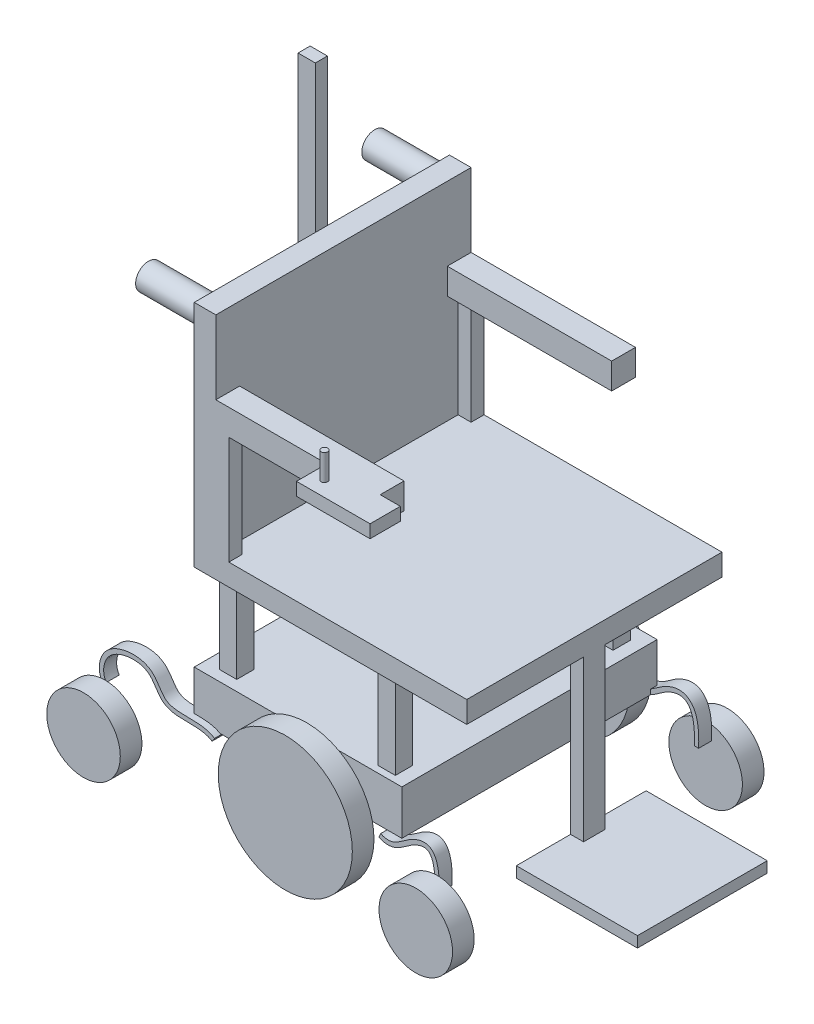
from build123d import *

# Parameters (mm, degrees)
SKETCH3_R            = 155
BOSS_EXTRUDE1_DEPTH  = 50
SKETCH9_R            = 33.926511192
BOSS_EXTRUDE3_DEPTH  = 590
BOSS_EXTRUDE4_START  = 50
SKETCH11_R           = 155
BOSS_EXTRUDE4_DEPTH  = 50
SKETCH12_W           = 480
SKETCH12_H           = 102.963387116
BOSS_EXTRUDE5_DEPTH  = 590
SKETCH15_W           = 40
SKETCH15_H           = 40
BOSS_EXTRUDE6_DEPTH  = 200
SKETCH16_W           = 40
SKETCH16_H           = 40
BOSS_EXTRUDE7_DEPTH  = 200
SKETCH17_W           = 40
SKETCH17_H           = 40
BOSS_EXTRUDE8_DEPTH  = 200
SKETCH18_W           = 40
SKETCH18_H           = 40
BOSS_EXTRUDE9_DEPTH  = 200
SKETCH20_W           = 480
SKETCH20_H           = 590
BOSS_EXTRUDE10_DEPTH = 50
SKETCH21_W           = 50
SKETCH21_H           = 590
BOSS_EXTRUDE11_DEPTH = 480
SKETCH23_R           = 30
BOSS_EXTRUDE12_DEPTH = 140
SKETCH24_R           = 30
BOSS_EXTRUDE13_DEPTH = 140
SKETCH40_W           = 30
SKETCH40_H           = 30
BOSS_EXTRUDE25_DEPTH = 250
SKETCH42_W           = 30
SKETCH42_H           = 30
BOSS_EXTRUDE26_DEPTH = 250
SKETCH45_W           = 380
SKETCH45_H           = 55
BOSS_EXTRUDE27_DEPTH = 60
SKETCH46_W           = 380
SKETCH46_H           = 55
BOSS_EXTRUDE28_DEPTH = 60
SKETCH48_W           = 590
SKETCH48_H           = 50
BOSS_EXTRUDE29_DEPTH = 150
SKETCH55_W           = 30
SKETCH55_H           = 50
BOSS_EXTRUDE31_DEPTH = 370
SKETCH58_W           = 280
SKETCH58_H           = 300
BOSS_EXTRUDE32_DEPTH = 25
EXTRUDE_THIN2_START  = -15
EXTRUDE_THIN2_DEPTH  = 30
SKETCH62_R           = 85
BOSS_EXTRUDE33_DEPTH = 50
EXTRUDE_THIN3_START  = -15
EXTRUDE_THIN3_DEPTH  = 30
SKETCH64_R           = 85
BOSS_EXTRUDE34_DEPTH = 50
EXTRUDE_THIN5_START  = -15
EXTRUDE_THIN5_DEPTH  = 30
EXTRUDE_THIN7_START  = -15
EXTRUDE_THIN7_DEPTH  = 30
SKETCH73_R           = 85
BOSS_EXTRUDE37_DEPTH = 50
SKETCH74_R           = 85
BOSS_EXTRUDE38_DEPTH = 50
SKETCH75_W           = 170
SKETCH75_H           = 30
BOSS_EXTRUDE39_DEPTH = 70
SKETCH76_R           = 7.5
BOSS_EXTRUDE40_DEPTH = 60
SKETCH77_W           = 27.937530969
SKETCH77_H           = 850
BOSS_EXTRUDE41_DEPTH = 40


# Read off the part's stored shape, not the designer's step: Extrude-Thin2, Extrude-Thin3, Extrude-Thin5, Extrude-Thin7
with BuildPart() as part:
    # Sketch3 → Boss-Extrude1 (new body)
    with BuildSketch(Plane.XY):
        with Locations((59.083093739, -136.412437016)):
            Circle(SKETCH3_R)
    extrude(amount=BOSS_EXTRUDE1_DEPTH)

    # Sketch9 → Boss-Extrude3 (add)
    with BuildSketch(Plane(origin=(0, 0, 0), x_dir=(-1, 0, 0), z_dir=(0, 0, -1))):
        with Locations((-59.083093739, -136.412437016)):
            Circle(SKETCH9_R)
    extrude(amount=BOSS_EXTRUDE3_DEPTH)

    # Sketch11 → Boss-Extrude4 (add)
    with BuildSketch(Plane(origin=(0, 0, -590), x_dir=(-1, 0, 0), z_dir=(0, 0, -1)).offset(BOSS_EXTRUDE4_START)):
        with Locations(Location((-59.083093739, -136.412437016, 0), (0, 0, 180))):
            Circle(SKETCH11_R)
    extrude(amount=-BOSS_EXTRUDE4_DEPTH)

    # Sketch12 → Boss-Extrude5 (add)
    with BuildSketch(Plane.XY.offset(-590)):
        with Locations((38.586487045, -51.481693558)):
            Rectangle(SKETCH12_W, SKETCH12_H)
    extrude(amount=BOSS_EXTRUDE5_DEPTH)

    # Sketch15 → Boss-Extrude6 (add)
    with BuildSketch(Plane(origin=(0, 0, 0), x_dir=(1, 0, 0), z_dir=(0, 1, 0))):
        with Locations((-143.865194173, 535.654594347)):
            Rectangle(SKETCH15_W, SKETCH15_H)
    extrude(amount=BOSS_EXTRUDE6_DEPTH)

    # Sketch16 → Boss-Extrude7 (add)
    with BuildSketch(Plane(origin=(0, 0, 0), x_dir=(1, 0, 0), z_dir=(0, 1, 0))):
        with Locations((229.11629966, 537.488381873)):
            Rectangle(SKETCH16_W, SKETCH16_H)
    extrude(amount=BOSS_EXTRUDE7_DEPTH)

    # Sketch17 → Boss-Extrude8 (add)
    with BuildSketch(Plane(origin=(0, 0, 0), x_dir=(1, 0, 0), z_dir=(0, 1, 0))):
        with Locations((-147.428064277, 44.245166341)):
            Rectangle(SKETCH17_W, SKETCH17_H)
    extrude(amount=BOSS_EXTRUDE8_DEPTH)

    # Sketch18 → Boss-Extrude9 (add)
    with BuildSketch(Plane(origin=(0, 0, 0), x_dir=(1, 0, 0), z_dir=(0, 1, 0))):
        with Locations((228.056842418, 35.446711217)):
            Rectangle(SKETCH18_W, SKETCH18_H)
    extrude(amount=BOSS_EXTRUDE9_DEPTH)

    # Sketch20 → Boss-Extrude10 (add)
    with BuildSketch(Plane(origin=(0, 200, 0), x_dir=(1, 0, 0), z_dir=(0, 1, 0))):
        with Locations((38.586487045, 295)):
            Rectangle(SKETCH20_W, SKETCH20_H)
    extrude(amount=BOSS_EXTRUDE10_DEPTH)

    # Sketch21 → Boss-Extrude11 (add)
    with BuildSketch(Plane(origin=(0, 250, 0), x_dir=(1, 0, 0), z_dir=(0, 1, 0))):
        with Locations((-176.413512955, 295)):
            Rectangle(SKETCH21_W, SKETCH21_H)
    extrude(amount=BOSS_EXTRUDE11_DEPTH)

    # Sketch23 → Boss-Extrude12 (add)
    with BuildSketch(Plane.ZY.offset(201.413512955)):
        with Locations(Location((-557.303178405, 697.091827005, 0), (0, 0, 180))):
            Circle(SKETCH23_R)
    extrude(amount=BOSS_EXTRUDE12_DEPTH)

    # Sketch24 → Boss-Extrude13 (add)
    with BuildSketch(Plane.ZY.offset(201.413512955)):
        with Locations(Location((-34.49114625, 695.325475635, 0), (0, 0, 180))):
            Circle(SKETCH24_R)
    extrude(amount=BOSS_EXTRUDE13_DEPTH)

    # Sketch40 → Boss-Extrude25 (add)
    with BuildSketch(Plane(origin=(0, 250, 0), x_dir=(1, 0, 0), z_dir=(0, 1, 0))):
        with Locations((-136.413512955, 15)):
            Rectangle(SKETCH40_W, SKETCH40_H)
    extrude(amount=BOSS_EXTRUDE25_DEPTH)

    # Sketch42 → Boss-Extrude26 (add)
    with BuildSketch(Plane(origin=(0, 250, 0), x_dir=(1, 0, 0), z_dir=(0, 1, 0))):
        with Locations((-136.413512955, 575)):
            Rectangle(SKETCH42_W, SKETCH42_H)
    extrude(amount=BOSS_EXTRUDE26_DEPTH)

    # Sketch45 → Boss-Extrude27 (add)
    with BuildSketch(Plane(origin=(0, 500, 0), x_dir=(1, 0, 0), z_dir=(0, 1, 0))):
        with Locations((38.586487045, 562.5)):
            Rectangle(SKETCH45_W, SKETCH45_H)
    extrude(amount=BOSS_EXTRUDE27_DEPTH)

    # Sketch46 → Boss-Extrude28 (add)
    with BuildSketch(Plane(origin=(0, 500, 0), x_dir=(1, 0, 0), z_dir=(0, 1, 0))):
        with Locations((38.586487045, 27.5)):
            Rectangle(SKETCH46_W, SKETCH46_H)
    extrude(amount=BOSS_EXTRUDE28_DEPTH)

    # Sketch48 → Boss-Extrude29 (add)
    with BuildSketch(Plane(origin=(278.586487045, 0, 0), x_dir=(0, 0, -1), z_dir=(1, 0, 0))):
        with Locations((295, 225)):
            Rectangle(SKETCH48_W, SKETCH48_H)
    extrude(amount=BOSS_EXTRUDE29_DEPTH)

    # Sketch55 → Boss-Extrude31 (add)
    with BuildSketch(Plane.XZ.offset(-200)):
        with Locations((413.586487045, -295)):
            Rectangle(SKETCH55_W, SKETCH55_H)
    extrude(amount=BOSS_EXTRUDE31_DEPTH)

    # Sketch58 → Boss-Extrude32 (add)
    with BuildSketch(Plane.XZ.offset(170)):
        with Locations((538.586487045, -294.597349054)):
            Rectangle(SKETCH58_W, SKETCH58_H)
    extrude(amount=BOSS_EXTRUDE32_DEPTH)

    # Extrude-Thin3 outline → Extrude-Thin3 (add)
    with BuildSketch(Plane.XY.offset(EXTRUDE_THIN3_START)):
        with BuildLine():
            Line((-145.070222728, -112.805694413), (-139.490171597, -104.507319309))
            add(Edge.make_bspline(
                [(-139.490171597, -104.507319309), (-141.07934136, -103.438718719), (-142.717912679, -102.475309527), (-146.066329191, -100.739710195), (-147.776160212, -99.967366778), (-152.982207486, -97.900745756), (-156.552965302, -96.855815655), (-163.8031578, -95.237844926), (-167.484455282, -94.664452977), (-174.907126528, -93.826813973), (-178.649185641, -93.562985527), (-186.144159647, -93.210750081), (-189.897218094, -93.122646574), (-197.354363274, -93.004015562), (-201.058455456, -92.97359066), (-208.346227164, -92.862142088), (-211.929878075, -92.781047653), (-218.894280326, -92.469359528), (-222.27488758, -92.238520889), (-228.741754545, -91.542444776), (-231.827437792, -91.076872695), (-237.613321297, -89.849742562), (-240.312032095, -89.088431948), (-245.262529472, -87.236577748), (-247.512831042, -86.148517588), (-250.568062019, -84.2399557), (-251.533967191, -83.55735024), (-252.912198127, -82.452991131), (-253.357343745, -82.073390914), (-254.253991896, -81.261386696), (-254.702424067, -80.83169464), (-256.048576921, -79.473156861), (-256.947051188, -78.474459999), (-258.747728739, -76.311448698), (-259.649790135, -75.147371638), (-262.370359099, -71.452133495), (-264.199970001, -68.718206192), (-268.018569401, -62.97989462), (-270.007806703, -59.975635165), (-273.280437529, -55.468611007), (-274.420207205, -53.966098787), (-276.834443872, -50.997417761), (-278.109020871, -49.531063348), (-280.834046544, -46.678358974), (-282.284800894, -45.291831023), (-284.232888356, -43.644155076), (-284.630037913, -43.318370525), (-285.431591992, -42.68131854), (-285.836459648, -42.369543951), (-287.062641187, -41.454341087), (-287.895526652, -40.87104465), (-292.12822171, -38.086263799), (-295.730018587, -36.281648856), (-303.17955344, -33.416042891), (-307.02820559, -32.35331616), (-314.848712225, -30.855288595), (-318.821552344, -30.419685634), (-326.79705508, -30.081442493), (-330.800151509, -30.178966373), (-336.762358097, -30.669393973), (-338.74270862, -30.89036097), (-342.678482687, -31.439368124), (-344.632018018, -31.766354523), (-350.469817445, -32.909213479), (-354.323210113, -33.888082504), (-361.870611832, -36.322411884), (-365.564912454, -37.777931243), (-372.701511464, -41.21698485), (-376.144208904, -43.200912351), (-382.66372669, -47.751282681), (-385.7406198, -50.318636899), (-391.384088149, -56.074189646), (-393.949669426, -59.263215713), (-396.735364688, -63.632801445), (-397.272067768, -64.527019132), (-398.297430375, -66.345718798), (-398.786136347, -67.269738549), (-400.180396171, -70.081097883), (-401.014205397, -72.007682713), (-403.224963678, -77.909482327), (-404.31300663, -82.006515208), (-405.655631413, -90.353285073), (-405.910536684, -94.604054026), (-405.4647068, -103.084766816), (-404.763539644, -107.317571097), (-402.853778418, -113.479860703), (-402.073620666, -115.502054606), (-400.201646884, -119.439318714), (-399.109533141, -121.354373822), (-397.85290485, -123.188008472)],
                knots=[0, 0, 0, 0, 0.015625, 0.015625, 0.03125, 0.03125, 0.0625, 0.0625, 0.09375, 0.09375, 0.125, 0.125, 0.15625, 0.15625, 0.1875, 0.1875, 0.21875, 0.21875, 0.25, 0.25, 0.28125, 0.28125, 0.3125, 0.3125, 0.34375, 0.34375, 0.359375, 0.359375, 0.3671875, 0.3671875, 0.375, 0.375, 0.390625, 0.390625, 0.40625, 0.40625, 0.4375, 0.4375, 0.46875, 0.46875, 0.484375, 0.484375, 0.5, 0.5, 0.515625, 0.515625, 0.51953125, 0.51953125, 0.5234375, 0.5234375, 0.53125, 0.53125, 0.5625, 0.5625, 0.59375, 0.59375, 0.625, 0.625, 0.65625, 0.65625, 0.671875, 0.671875, 0.6875, 0.6875, 0.71875, 0.71875, 0.75, 0.75, 0.78125, 0.78125, 0.8125, 0.8125, 0.84375, 0.84375, 0.8515625, 0.8515625, 0.859375, 0.859375, 0.875, 0.875, 0.90625, 0.90625, 0.9375, 0.9375, 0.96875, 0.96875, 0.984375, 0.984375, 1, 1, 1, 1], degree=3))
            Line((-397.85290485, -123.188008472), (-389.60410345, -117.534931835))
            add(Edge.make_bspline(
                [(-145.070222728, -112.805694413), (-174.298194853, -93.152018019), (-255.832825757, -122.597665391), (-285.24236823, -42.37571878), (-344.071657242, -36.271663834), (-395.211004918, -61.34237244), (-398.759966767, -104.174968226), (-389.60410345, -117.534931835)],
                knots=[0, 0, 0, 0, 0.363118582, 0.517751509, 0.679382964, 0.849227462, 1, 1, 1, 1], degree=3))
        make_face()
    extrude(amount=EXTRUDE_THIN3_DEPTH)

    # Sketch64 → Boss-Extrude34 (add)
    with BuildSketch(Plane.XY.offset(15)):
        with Locations(Location((-392.315324972, -199.199512235, 0), (0, 0, 89.515735764))):
            Circle(SKETCH64_R)
    extrude(amount=BOSS_EXTRUDE34_DEPTH)

    # Extrude-Thin5 outline → Extrude-Thin5 (add)
    with BuildSketch(Plane(origin=(0, 0, -590), x_dir=(-1, 0, 0), z_dir=(0, 0, -1)).offset(EXTRUDE_THIN5_START)):
        with BuildLine():
            Line((-244.508697819, -102.963387116), (-248.680429953, -93.875117149))
            add(Edge.make_bspline(
                [(-248.680429953, -93.875117149), (-250.610997568, -94.761293614), (-252.407714818, -95.427505315), (-255.767025602, -96.406006016), (-257.329553634, -96.719132751), (-260.288112257, -97.072435956), (-261.685103961, -97.113239977), (-264.402979395, -96.971478136), (-265.724995436, -96.788466218), (-268.370038862, -96.212368135), (-269.693216359, -95.818366627), (-272.38197324, -94.821266306), (-273.747013263, -94.217728303), (-276.533203468, -92.813348956), (-277.953858774, -92.012551422), (-280.855246294, -90.241554097), (-282.335741241, -89.271532323), (-286.875742085, -86.166491977), (-290.030334632, -83.835059819), (-295.042313993, -80.230895287), (-296.762052925, -79.011066418), (-300.313596629, -76.593761036), (-302.120978695, -75.412398909), (-307.625110892, -71.982193856), (-311.402932873, -69.846646459), (-319.124696701, -66.05765138), (-323.068515174, -64.40287319), (-329.094319848, -62.441208221), (-331.121582411, -61.874453342), (-335.212620704, -60.949868389), (-337.276589936, -60.591968607), (-341.437325506, -60.128024883), (-343.534435892, -60.022052916), (-347.746649869, -60.113903765), (-349.862098333, -60.312136331), (-354.073860161, -61.066849478), (-356.170047259, -61.62404719), (-360.278501933, -63.136087075), (-362.289865552, -64.091294092), (-366.15131741, -66.404368336), (-368.000455114, -67.761634869), (-371.479147149, -70.851621543), (-373.108648528, -72.583384647), (-376.126550149, -76.389691431), (-377.515534694, -78.463822935), (-380.057687052, -82.939993327), (-381.211362948, -85.342159373), (-383.296184605, -90.480862277), (-384.227542183, -93.217666184), (-385.877826444, -99.046071787), (-386.596777459, -102.137870544), (-388.440795104, -111.985721969), (-389.254920731, -119.314630369), (-390.023263528, -135.728308284), (-389.976273791, -144.813573569), (-389.461083679, -154.885649976)],
                knots=[0, 0, 0, 0, 0.03125, 0.03125, 0.0625, 0.0625, 0.09375, 0.09375, 0.125, 0.125, 0.15625, 0.15625, 0.1875, 0.1875, 0.21875, 0.21875, 0.25, 0.25, 0.3125, 0.3125, 0.34375, 0.34375, 0.375, 0.375, 0.4375, 0.4375, 0.5, 0.5, 0.53125, 0.53125, 0.5625, 0.5625, 0.59375, 0.59375, 0.625, 0.625, 0.65625, 0.65625, 0.6875, 0.6875, 0.71875, 0.71875, 0.75, 0.75, 0.78125, 0.78125, 0.8125, 0.8125, 0.84375, 0.84375, 0.875, 0.875, 0.9375, 0.9375, 1, 1, 1, 1], degree=3))
            Line((-389.461083679, -154.885649976), (-379.47413985, -154.374814424))
            add(Edge.make_bspline(
                [(-244.508697819, -102.963387116), (-270.203619867, -114.757967646), (-315.367274212, -67.847381848), (-384.74280362, -51.371315701), (-379.47413985, -154.374814424)],
                knots=[0, 0, 0, 0, 0.342817276, 1, 1, 1, 1], degree=3))
        make_face()
    extrude(amount=EXTRUDE_THIN5_DEPTH)

    # Sketch74 → Boss-Extrude38 (add)
    with BuildSketch(Plane(origin=(0, 0, -605), x_dir=(-1, 0, 0), z_dir=(0, 0, -1))):
        with Locations(Location((-375.753605065, -206.417064861, 0), (0, 0, 85.588503232))):
            Circle(SKETCH74_R)
    extrude(amount=BOSS_EXTRUDE38_DEPTH)

    # Sketch75 → Boss-Extrude39 (add)
    with BuildSketch(Plane.XY):
        with Locations((190.025425106, 545)):
            Rectangle(SKETCH75_W, SKETCH75_H)
    extrude(amount=BOSS_EXTRUDE39_DEPTH)

    # Sketch76 → Boss-Extrude40 (add)
    with BuildSketch(Plane(origin=(0, 560, 0), x_dir=(1, 0, 0), z_dir=(0, 1, 0))):
        with Locations(Location((134.484292139, -34.923942876, 0), (0, 0, 90))):
            Circle(SKETCH76_R)
    extrude(amount=BOSS_EXTRUDE40_DEPTH)

    # Sketch77 → Boss-Extrude41 (add)
    with BuildSketch(Plane.ZY.offset(201.413512955)):
        with Locations((-293.968765485, 644.291467569)):
            Rectangle(SKETCH77_W, SKETCH77_H)
    extrude(amount=BOSS_EXTRUDE41_DEPTH)


with BuildPart() as body_2:
    # Extrude-Thin2 outline → Extrude-Thin2 (new body)
    with BuildSketch(Plane(origin=(0, 0, -590), x_dir=(-1, 0, 0), z_dir=(0, 0, -1)).offset(EXTRUDE_THIN2_START)):
        with BuildLine():
            Line((146.839117035, -102.963387116), (145.070222728, -112.805694413))
            add(Edge.make_bspline(
                [(145.070222728, -112.805694413), (160.002817863, -115.489433268), (175.068393499, -116.138135997), (204.681759881, -113.240431437), (219.229741576, -109.692125609), (240.036524063, -101.151316741), (246.802453164, -97.768454671), (256.616232083, -91.887540538), (259.831635578, -89.792849517), (263.772730728, -87.006598475), (264.557042171, -86.440954877), (266.11764311, -85.292887111), (266.894599898, -84.709769656), (269.202555848, -82.944929089), (270.714002239, -81.74600541), (275.178904092, -78.106982), (278.063314601, -75.624772006), (283.704175868, -70.674407459), (286.460665602, -68.206148833), (291.889447942, -63.406381257), (294.561769437, -61.074953172), (299.852234217, -56.668756107), (302.470318713, -54.594304344), (307.668521458, -50.813459735), (310.248151736, -49.107625189), (315.378392943, -46.153531478), (317.927591068, -44.905503935), (323.025578299, -42.919508758), (325.572878928, -42.17994688), (329.46708279, -41.475689263), (330.800706311, -41.30477324), (333.535102109, -41.09090541), (334.934875939, -41.048148468), (339.213131175, -41.113039212), (342.170893224, -41.414596986), (348.179868872, -42.520954956), (351.230612711, -43.325580698), (357.300593035, -45.403692207), (360.319665767, -46.677003537), (366.204649409, -49.643041536), (369.070483392, -51.335673081), (374.533496449, -55.080028962), (377.130563969, -57.1316908), (381.949130256, -61.525025345), (384.170426512, -63.866553009), (388.143673226, -68.76435912), (389.895391408, -71.320209448), (392.855816511, -76.572966091), (394.064632886, -79.269013749), (395.88942165, -84.749089858), (396.506474909, -87.532367981), (397.10609104, -93.181891318), (397.090273102, -96.048983109), (396.346254081, -101.913468681), (395.618018151, -104.913141751), (393.302818523, -111.091262324), (391.714054127, -114.270641738), (389.60410345, -117.534931835)],
                knots=[0, 0, 0, 0, 0.125, 0.125, 0.25, 0.25, 0.3125, 0.3125, 0.34375, 0.34375, 0.3515625, 0.3515625, 0.359375, 0.359375, 0.375, 0.375, 0.40625, 0.40625, 0.4375, 0.4375, 0.46875, 0.46875, 0.5, 0.5, 0.53125, 0.53125, 0.5625, 0.5625, 0.59375, 0.59375, 0.609375, 0.609375, 0.625, 0.625, 0.65625, 0.65625, 0.6875, 0.6875, 0.71875, 0.71875, 0.75, 0.75, 0.78125, 0.78125, 0.8125, 0.8125, 0.84375, 0.84375, 0.875, 0.875, 0.90625, 0.90625, 0.9375, 0.9375, 0.96875, 0.96875, 1, 1, 1, 1], degree=3))
            Line((389.60410345, -117.534931835), (398.00242907, -122.96338712))
            add(Edge.make_bspline(
                [(146.839117035, -102.963387116), (186.810498221, -110.147185231), (254.76023315, -96.172432565), (333.289864106, 4.557830753), (430.163886093, -73.206619431), (398.00242907, -122.96338712)],
                knots=[0, 0, 0, 0, 0.355455615, 0.594071651, 1, 1, 1, 1], degree=3))
        make_face()
    extrude(amount=EXTRUDE_THIN2_DEPTH)

    # Sketch62 → Boss-Extrude33 (add)
    with BuildSketch(Plane(origin=(0, 0, -605), x_dir=(-1, 0, 0), z_dir=(0, 0, -1))):
        with Locations(Location((392.315324972, -199.199512235, 0), (0, 0, 90.484264236))):
            Circle(SKETCH62_R)
    extrude(amount=BOSS_EXTRUDE33_DEPTH)


with BuildPart() as body_3:
    # Extrude-Thin7 outline → Extrude-Thin7 (new body)
    with BuildSketch(Plane.XY.offset(EXTRUDE_THIN7_START)):
        with BuildLine():
            Line((244.508697819, -102.963387116), (240.336965684, -112.051657083))
            add(Edge.make_bspline(
                [(240.336965684, -112.051657083), (243.090912939, -113.315784393), (245.808996745, -114.336599841), (251.179422816, -115.900898596), (253.831830586, -116.443544166), (259.042840679, -117.065829137), (261.600481893, -117.144840986), (266.571131781, -116.885576537), (268.983008145, -116.547746296), (273.624571388, -115.53680044), (275.854108156, -114.864600167), (280.129164036, -113.279235711), (282.17522251, -112.36651072), (286.109175899, -110.383601269), (287.997565693, -109.313373001), (291.651777346, -107.082854322), (293.417836474, -105.922385894), (298.58310487, -102.389706645), (301.852834512, -99.967660421), (306.6459267, -96.520899846), (308.222671489, -95.403658226), (311.359737965, -93.268460602), (312.943556247, -92.233659893), (317.714153238, -89.260597961), (320.920988243, -87.454262731), (327.227239426, -84.359846062), (330.326778978, -83.073095132), (334.751806611, -81.632553633), (336.189120696, -81.233587559), (338.962795703, -80.606730025), (340.298963124, -80.378908273), (342.847689113, -80.094712027), (344.059903632, -80.03826556), (346.349155969, -80.088184622), (347.425848912, -80.194140402), (349.454814649, -80.557714408), (350.407213708, -80.814615503), (352.226004347, -81.483987373), (353.093299883, -81.896093305), (354.792867583, -82.914162781), (355.626090281, -83.52072702), (357.289448543, -84.998223392), (358.119637062, -85.870112563), (359.772072977, -87.954235514), (360.593736072, -89.166881468), (362.197464984, -91.99069486), (362.97902272, -93.601735138), (364.462882565, -97.259177429), (365.164972858, -99.305312391), (366.453426827, -103.855820755), (367.03976617, -106.359997094), (368.579825707, -114.584580819), (369.312693006, -121.016642334), (370.009244995, -135.896693323), (369.974136591, -144.344187028), (369.487196021, -153.863978872)],
                knots=[0, 0, 0, 0, 0.03125, 0.03125, 0.0625, 0.0625, 0.09375, 0.09375, 0.125, 0.125, 0.15625, 0.15625, 0.1875, 0.1875, 0.21875, 0.21875, 0.25, 0.25, 0.3125, 0.3125, 0.34375, 0.34375, 0.375, 0.375, 0.4375, 0.4375, 0.5, 0.5, 0.53125, 0.53125, 0.5625, 0.5625, 0.59375, 0.59375, 0.625, 0.625, 0.65625, 0.65625, 0.6875, 0.6875, 0.71875, 0.71875, 0.75, 0.75, 0.78125, 0.78125, 0.8125, 0.8125, 0.84375, 0.84375, 0.875, 0.875, 0.9375, 0.9375, 1, 1, 1, 1], degree=3))
            Line((369.487196021, -153.863978872), (379.47413985, -154.374814424))
            add(Edge.make_bspline(
                [(244.508697819, -102.963387116), (270.203619867, -114.757967646), (315.367274212, -67.847381848), (384.74280362, -51.371315701), (379.47413985, -154.374814424)],
                knots=[0, 0, 0, 0, 0.342817276, 1, 1, 1, 1], degree=3))
        make_face()
    extrude(amount=EXTRUDE_THIN7_DEPTH)

    # Sketch73 → Boss-Extrude37 (add)
    with BuildSketch(Plane.XY.offset(15)):
        with Locations(Location((375.753605065, -206.417064861, 0), (0, 0, 94.411496768))):
            Circle(SKETCH73_R)
    extrude(amount=BOSS_EXTRUDE37_DEPTH)


solid = Compound([part.part, body_2.part, body_3.part])
